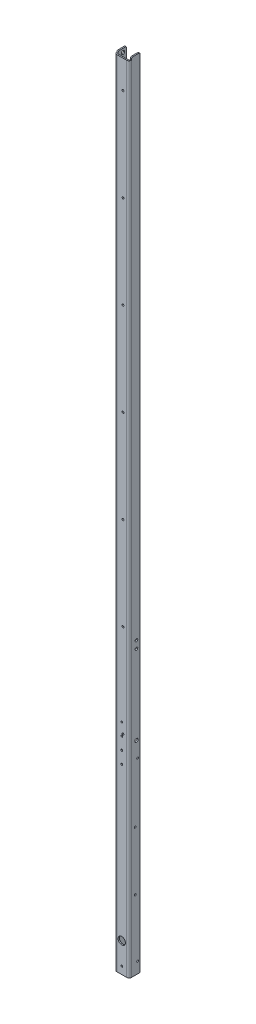
from build123d import *

# Parameters (mm, degrees)
BASE_FLANGE1_DEPTH = 2070.1
SKETCH6_R          = 2.4511
SKETCH6_R_2        = 4.3688
SKETCH6_R_3        = 3.429
CUT_EXTRUDE1_DEPTH = 6.35
SKETCH7_R          = 2.4511
SKETCH7_R_2        = 9.525
CUT_EXTRUDE2_DEPTH = 3.175
SKETCH8_R          = 3.175
SKETCH8_R_2        = 4.3688
SKETCH8_R_3        = 3.429
CUT_EXTRUDE3_DEPTH = 3.175
SKETCH9_W          = 38.1
SKETCH9_H          = 6.35
CUT_EXTRUDE4_DEPTH = 6.35
SKETCH10_W         = 3.175
SKETCH10_H         = 22.225
CUT_EXTRUDE5_DEPTH = 3.175
FILLET1_R          = 3.175


# Sheet-metal steps are written as plain solids
with BuildPart() as part:
    # Sketch1 → Base-Flange1 (new body)
    with BuildSketch(Plane(origin=(0, 0, 0), x_dir=(1, 0, 0), z_dir=(0, 1, 0))):
        with BuildLine():
            Line((0, 28.575), (0, 6.35))
            ThreePointArc((0, 6.35), (1.859871939, 1.859871939), (6.35, 0))
            Line((6.35, 0), (31.75, 0))
            ThreePointArc((31.75, 0), (36.240128061, 1.859871939), (38.1, 6.35))
            Line((38.1, 6.35), (38.1, 28.575))
            Line((38.1, 28.575), (34.925, 28.575))
            Line((34.925, 28.575), (34.925, 6.35))
            ThreePointArc((34.925, 6.35), (33.99506403, 4.10493597), (31.75, 3.175))
            Line((31.75, 3.175), (6.35, 3.175))
            ThreePointArc((6.35, 3.175), (4.10493597, 4.10493597), (3.175, 6.35))
            Line((3.175, 6.35), (3.175, 28.575))
            Line((3.175, 28.575), (0, 28.575))
        make_face()
    extrude(amount=BASE_FLANGE1_DEPTH)

    # Sketch6 → Cut-Extrude1 (cut)
    with BuildSketch(Plane(origin=(38.1, 0, 0), x_dir=(0, 0, -1), z_dir=(1, 0, 0))):
        with Locations((22.225, 28.575)):
            Circle(SKETCH6_R)
        with Locations((22.225, 485.775)):
            Circle(SKETCH6_R)
        with Locations((19.05, 527.05)):
            Circle(SKETCH6_R_2)
        with Locations((19.05, 752.475)):
            Circle(SKETCH6_R_3)
        with Locations((19.05, 733.425)):
            Circle(SKETCH6_R_3)
        with Locations((15.875, 180.975)):
            Circle(SKETCH6_R)
        with Locations((15.875, 333.375)):
            Circle(SKETCH6_R)
    extrude(amount=-CUT_EXTRUDE1_DEPTH, mode=Mode.SUBTRACT)

    # Sketch7 → Cut-Extrude2 (cut)
    with BuildSketch(Plane(origin=(0, 0, -3.175), x_dir=(-1, 0, 0), z_dir=(0, 0, -1))):
        with Locations((-19.05, 19.05)):
            Circle(SKETCH7_R)
        with Locations((-22.225, 542.9153787)):
            Circle(SKETCH7_R)
        with Locations((-22.225, 784.2153787)):
            Circle(SKETCH7_R)
        with Locations((-22.225, 1025.5153787)):
            Circle(SKETCH7_R)
        with Locations((-22.225, 1266.8153787)):
            Circle(SKETCH7_R)
        with Locations((-22.225, 1508.1153787)):
            Circle(SKETCH7_R)
        with Locations((-22.225, 1749.4153787)):
            Circle(SKETCH7_R)
        with Locations((-22.225, 1990.7153787)):
            Circle(SKETCH7_R)
        with Locations((-19.05, 473.075)):
            Circle(SKETCH7_R)
        with Locations((-19.05, 504.825)):
            Circle(SKETCH7_R)
        with Locations((-19.05, 536.575)):
            Circle(SKETCH7_R)
        with Locations((-19.05, 568.325)):
            Circle(SKETCH7_R)
        with Locations((-19.05, 76.2)):
            Circle(SKETCH7_R_2)
    extrude(amount=-CUT_EXTRUDE2_DEPTH, mode=Mode.SUBTRACT)

    # Sketch8 → Cut-Extrude3 (cut)
    with BuildSketch(Plane.ZY):
        with Locations((-19.05, 1968.5)):
            Circle(SKETCH8_R)
        with Locations((-19.05, 1949.45)):
            Circle(SKETCH8_R)
        with Locations((-19.05, 1892.3)):
            Circle(SKETCH8_R)
        with Locations((-19.05, 1873.25)):
            Circle(SKETCH8_R)
        with Locations((-19.05, 1816.1)):
            Circle(SKETCH8_R)
        with Locations((-19.05, 1797.05)):
            Circle(SKETCH8_R)
        with Locations((-19.05, 1739.9)):
            Circle(SKETCH8_R)
        with Locations((-19.05, 1720.85)):
            Circle(SKETCH8_R)
        with Locations((-19.05, 1663.7)):
            Circle(SKETCH8_R)
        with Locations((-19.05, 1644.65)):
            Circle(SKETCH8_R)
        with Locations((-19.05, 1587.5)):
            Circle(SKETCH8_R)
        with Locations((-19.05, 1568.45)):
            Circle(SKETCH8_R)
        with Locations((-19.05, 1511.3)):
            Circle(SKETCH8_R)
        with Locations((-19.05, 1492.25)):
            Circle(SKETCH8_R)
        with Locations((-19.05, 1435.1)):
            Circle(SKETCH8_R)
        with Locations((-19.05, 1416.05)):
            Circle(SKETCH8_R)
        with Locations((-19.05, 1358.9)):
            Circle(SKETCH8_R)
        with Locations((-19.05, 1339.85)):
            Circle(SKETCH8_R)
        with Locations((-19.05, 1282.7)):
            Circle(SKETCH8_R)
        with Locations((-19.05, 1263.65)):
            Circle(SKETCH8_R)
        with Locations((-19.05, 1206.5)):
            Circle(SKETCH8_R)
        with Locations((-19.05, 1187.45)):
            Circle(SKETCH8_R)
        with Locations((-19.05, 1130.3)):
            Circle(SKETCH8_R)
        with Locations((-19.05, 1111.25)):
            Circle(SKETCH8_R)
        with Locations((-19.05, 1054.1)):
            Circle(SKETCH8_R)
        with Locations((-19.05, 1035.05)):
            Circle(SKETCH8_R)
        with Locations((-19.05, 977.9)):
            Circle(SKETCH8_R)
        with Locations((-19.05, 958.85)):
            Circle(SKETCH8_R)
        with Locations((-19.05, 901.7)):
            Circle(SKETCH8_R)
        with Locations((-19.05, 882.65)):
            Circle(SKETCH8_R)
        with Locations((-19.05, 825.5)):
            Circle(SKETCH8_R)
        with Locations((-19.05, 806.45)):
            Circle(SKETCH8_R)
        with Locations((-19.05, 749.3)):
            Circle(SKETCH8_R)
        with Locations((-19.05, 730.25)):
            Circle(SKETCH8_R)
        with Locations((-19.05, 673.1)):
            Circle(SKETCH8_R)
        with Locations((-19.05, 654.05)):
            Circle(SKETCH8_R)
        with Locations((-19.05, 596.9)):
            Circle(SKETCH8_R)
        with Locations((-19.05, 577.85)):
            Circle(SKETCH8_R)
        with Locations((-19.05, 2057.4)):
            Circle(SKETCH8_R_2)
        with Locations((-19.05, 2038.35)):
            Circle(SKETCH8_R_2)
        with Locations((-19.099035462, 546.1)):
            Circle(SKETCH8_R_3)
        with Locations((-19.050989584, 527.050060588)):
            Circle(SKETCH8_R_3)
        with BuildLine():
            Line((-28.575, 41.275), (-15.875, 41.275))
            ThreePointArc((-15.875, 41.275), (-11.384871939, 39.415128061), (-9.525, 34.925))
            Line((-9.525, 34.925), (-9.525, 22.225))
            ThreePointArc((-9.525, 22.225), (-11.384871939, 17.734871939), (-15.875, 15.875))
            Line((-15.875, 15.875), (-28.575, 15.875))
            Line((-28.575, 15.875), (-28.575, 41.275))
        make_face()
        with BuildLine():
            Line((-28.575, 193.675), (-15.875, 193.675))
            ThreePointArc((-15.875, 193.675), (-11.384871939, 191.815128061), (-9.525, 187.325))
            Line((-9.525, 187.325), (-9.525, 174.625))
            ThreePointArc((-9.525, 174.625), (-11.384871939, 170.134871939), (-15.875, 168.275))
            Line((-15.875, 168.275), (-28.575, 168.275))
            Line((-28.575, 168.275), (-28.575, 193.675))
        make_face()
        with BuildLine():
            Line((-28.575, 346.075), (-15.875, 346.075))
            ThreePointArc((-15.875, 346.075), (-11.384871939, 344.215128061), (-9.525, 339.725))
            Line((-9.525, 339.725), (-9.525, 327.025))
            ThreePointArc((-9.525, 327.025), (-11.384871939, 322.534871939), (-15.875, 320.675))
            Line((-15.875, 320.675), (-28.575, 320.675))
            Line((-28.575, 320.675), (-28.575, 346.075))
        make_face()
        with BuildLine():
            Line((-28.575, 498.475), (-15.875, 498.475))
            ThreePointArc((-15.875, 498.475), (-11.384871939, 496.615128061), (-9.525, 492.125))
            Line((-9.525, 492.125), (-9.525, 479.425))
            ThreePointArc((-9.525, 479.425), (-11.384871939, 474.934871939), (-15.875, 473.075))
            Line((-15.875, 473.075), (-28.575, 473.075))
            Line((-28.575, 473.075), (-28.575, 498.475))
        make_face()
    extrude(amount=-CUT_EXTRUDE3_DEPTH, mode=Mode.SUBTRACT)

    # Sketch9 → Cut-Extrude4 (cut)
    with BuildSketch(Plane(origin=(0, 2070.1, 0), x_dir=(1, 0, 0), z_dir=(0, 1, 0))):
        with Locations((19.05, 3.175)):
            Rectangle(SKETCH9_W, SKETCH9_H)
    extrude(amount=-CUT_EXTRUDE4_DEPTH, mode=Mode.SUBTRACT)

    # Sketch10 → Cut-Extrude5 (cut)
    with BuildSketch(Plane(origin=(0, 2070.1, 0), x_dir=(1, 0, 0), z_dir=(0, 1, 0))):
        with Locations((1.5875, 17.4625)):
            Rectangle(SKETCH10_W, SKETCH10_H)
    extrude(amount=-CUT_EXTRUDE5_DEPTH, mode=Mode.SUBTRACT)

    # Fillet1
    fillet1_edges = [part.edges().sort_by_distance(p)[0] for p in [
        (1.5875, 498.475, -28.575),
        (1.5875, 473.075, -28.575),
        (1.5875, 346.075, -28.575),
        (1.5875, 320.675, -28.575),
        (1.5875, 193.675, -28.575),
        (1.5875, 168.275, -28.575),
        (1.5875, 41.275, -28.575),
        (1.5875, 15.875, -28.575),
        (1.5875, 0, -28.575),
        (36.5125, 0, -28.575),
        (36.5125, 2070.1, -6.35),
        (1.5875, 2066.925, -6.35),
        (36.5125, 2070.1, -28.575),
        (1.5875, 2066.925, -28.575),
    ]]
    fillet(fillet1_edges, radius=FILLET1_R - 0.0001)  # a hair under: the kernel refuses the full size


solid = part.part
